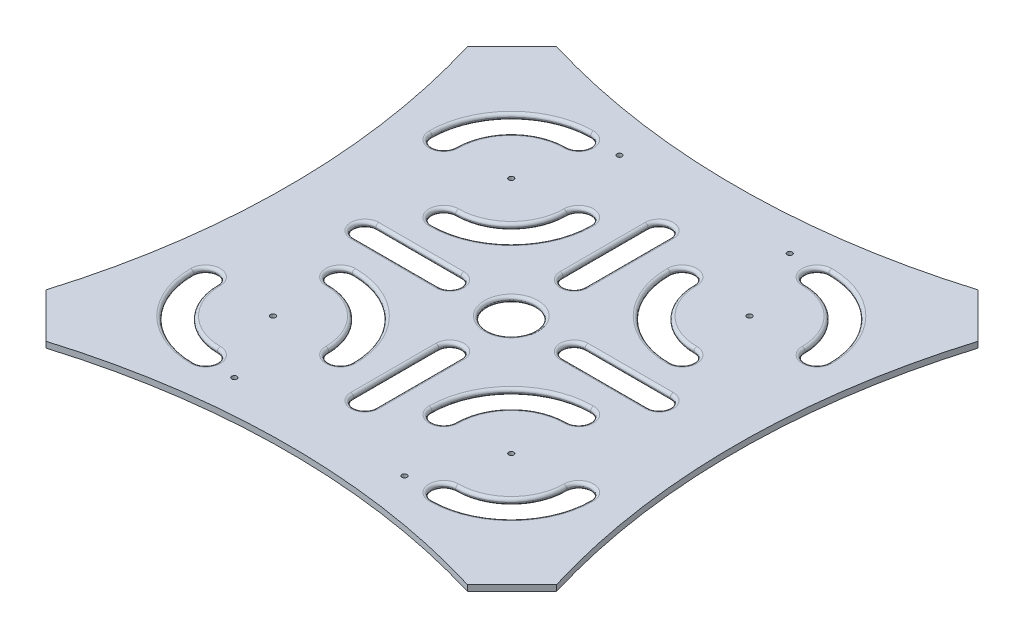
from build123d import *
from OCP.BRepAlgoAPI import BRepAlgoAPI_Cut
from OCP.TopTools import TopTools_ListOfShape

# Parameters (mm, degrees)
IZIM1_W                     = 300
IZIM1_H                     = 3.5
Y_KSEKLIK_EKSTR_ZYON1_DEPTH = 300
KES_EKSTR_ZYON5_DEPTH       = 10
IZIM10_R                    = 14
IZIM10_R_2                  = 1.5
KES_EKSTR_ZYON6_DEPTH       = 10
KES_EKSTR_ZYON8_DEPTH       = 10
KES_EKSTR_ZYON9_DEPTH       = 10
KES_EKSTR_ZYON10_DEPTH      = 10
RADYUS1_R                   = 1.75
RADYUS2_R                   = 1.75
L_EK1_SCALE                 = 0.5
IZIM17_R                    = 0.75
KES_EKSTR_ZYON12_DEPTH      = 10


with BuildPart() as part:
    # Çizim1 → Yükseklik-Ekstrüzyon1 (new body)
    with BuildSketch(Plane.XY):
        with Locations((150, 1.75)):
            Rectangle(IZIM1_W, IZIM1_H)
    extrude(amount=-Y_KSEKLIK_EKSTR_ZYON1_DEPTH)

    # Çizim8 → Kes-Ekstrüzyon5 (cut)
    with BuildSketch(Plane(origin=(0, 3.5, 0), x_dir=(1, 0, 0), z_dir=(0, 1, 0))):
        with BuildLine():
            Line((186.501870643, 156.494268219), (236.501870643, 156.494268219))
            ThreePointArc((236.501870643, 156.494268219), (242.996138862, 150), (236.501870643, 143.505731781))
            Line((236.501870643, 143.505731781), (186.501870643, 143.505731781))
            ThreePointArc((186.501870643, 143.505731781), (180.007602424, 150), (186.501870643, 156.494268219))
        make_face()
        with BuildLine():
            Line((143.505731781, 186.501870643), (143.505731781, 236.501870643))
            ThreePointArc((143.505731781, 236.501870643), (150, 242.996138862), (156.494268219, 236.501870643))
            Line((156.494268219, 236.501870643), (156.494268219, 186.501870643))
            ThreePointArc((156.494268219, 186.501870643), (150, 180.007602424), (143.505731781, 186.501870643))
        make_face()
        with BuildLine():
            Line((156.494268219, 113.498129357), (156.494268219, 63.498129357))
            ThreePointArc((156.494268219, 63.498129357), (150, 57.003861138), (143.505731781, 63.498129357))
            Line((143.505731781, 63.498129357), (143.505731781, 113.498129357))
            ThreePointArc((143.505731781, 113.498129357), (150, 119.992397576), (156.494268219, 113.498129357))
        make_face()
        with BuildLine():
            Line((113.498129357, 143.505731781), (63.498129357, 143.505731781))
            ThreePointArc((63.498129357, 143.505731781), (57.003861138, 150), (63.498129357, 156.494268219))
            Line((63.498129357, 156.494268219), (113.498129357, 156.494268219))
            ThreePointArc((113.498129357, 156.494268219), (119.992397576, 150), (113.498129357, 143.505731781))
        make_face()
    extrude(amount=-KES_EKSTR_ZYON5_DEPTH, mode=Mode.SUBTRACT)

    # Çizim10 → Kes-Ekstrüzyon6 (cut)
    with BuildSketch(Plane(origin=(0, 3.5, 0), x_dir=(1, 0, 0), z_dir=(0, 1, 0))):
        with Locations(Location((150, 149.58282898, 0), (0, 0, 270))):
            Circle(IZIM10_R)
        with Locations(Location((80, 219.58282898, 0), (0, 0, 270))):
            Circle(IZIM10_R_2)
        with Locations(Location((220, 219.58282898, 0), (0, 0, 270))):
            Circle(IZIM10_R_2)
        with Locations(Location((220, 79.58282898, 0), (0, 0, 90))):
            Circle(IZIM10_R_2)
        with Locations(Location((80, 79.58282898, 0), (0, 0, 90))):
            Circle(IZIM10_R_2)
    extrude(amount=-KES_EKSTR_ZYON6_DEPTH, mode=Mode.SUBTRACT)

    # Çizim13 → Kes-Ekstrüzyon8 (cut)
    with BuildSketch(Plane(origin=(0, 3.5, 0), x_dir=(1, 0, 0), z_dir=(0, 1, 0))):
        with BuildLine():
            ThreePointArc((80, 172.99784985), (112.940554645, 186.642274336), (126.58497913, 219.58282898))
            ThreePointArc((126.58497913, 219.58282898), (119.654189369, 226.513618742), (112.723399607, 219.58282898))
            ThreePointArc((112.723399607, 219.58282898), (103.138937765, 196.443891215), (80, 186.859429373))
            ThreePointArc((80, 186.859429373), (73.069210238, 179.928639612), (80, 172.99784985))
        make_face()
        with BuildLine():
            ThreePointArc((33.41502087, 219.58282898), (47.059445355, 252.523383625), (80, 266.16780811))
            ThreePointArc((80, 266.16780811), (86.930789762, 259.237018349), (80, 252.306228587))
            ThreePointArc((80, 252.306228587), (56.861062235, 242.721766745), (47.276600393, 219.58282898))
            ThreePointArc((47.276600393, 219.58282898), (40.345810631, 212.652039218), (33.41502087, 219.58282898))
        make_face()
        with BuildLine():
            ThreePointArc((220, 172.99784985), (187.059445355, 186.642274336), (173.41502087, 219.58282898))
            ThreePointArc((173.41502087, 219.58282898), (180.345810631, 226.513618742), (187.276600393, 219.58282898))
            ThreePointArc((187.276600393, 219.58282898), (196.861062235, 196.443891215), (220, 186.859429373))
            ThreePointArc((220, 186.859429373), (226.930789762, 179.928639612), (220, 172.99784985))
        make_face()
        with BuildLine():
            ThreePointArc((266.58497913, 219.58282898), (252.940554645, 252.523383625), (220, 266.16780811))
            ThreePointArc((220, 266.16780811), (213.069210238, 259.237018349), (220, 252.306228587))
            ThreePointArc((220, 252.306228587), (243.138937765, 242.721766745), (252.723399607, 219.58282898))
            ThreePointArc((252.723399607, 219.58282898), (259.654189369, 212.652039218), (266.58497913, 219.58282898))
        make_face()
        with BuildLine():
            ThreePointArc((33.41502087, 79.58282898), (47.059445355, 46.642274336), (80, 32.99784985))
            ThreePointArc((80, 32.99784985), (86.930789762, 39.928639612), (80, 46.859429373))
            ThreePointArc((80, 46.859429373), (56.861062235, 56.443891215), (47.276600393, 79.58282898))
            ThreePointArc((47.276600393, 79.58282898), (40.345810631, 86.513618742), (33.41502087, 79.58282898))
        make_face()
        with BuildLine():
            ThreePointArc((80, 126.16780811), (112.940554645, 112.523383625), (126.58497913, 79.58282898))
            ThreePointArc((126.58497913, 79.58282898), (119.654189369, 72.652039218), (112.723399607, 79.58282898))
            ThreePointArc((112.723399607, 79.58282898), (103.138937765, 102.721766745), (80, 112.306228587))
            ThreePointArc((80, 112.306228587), (73.069210238, 119.237018349), (80, 126.16780811))
        make_face()
        with BuildLine():
            ThreePointArc((220, 126.16780811), (187.059445355, 112.523383625), (173.41502087, 79.58282898))
            ThreePointArc((173.41502087, 79.58282898), (180.345810631, 72.652039218), (187.276600393, 79.58282898))
            ThreePointArc((187.276600393, 79.58282898), (196.861062235, 102.721766745), (220, 112.306228587))
            ThreePointArc((220, 112.306228587), (226.930789762, 119.237018349), (220, 126.16780811))
        make_face()
        with BuildLine():
            ThreePointArc((266.58497913, 79.58282898), (252.940554645, 46.642274336), (220, 32.99784985))
            ThreePointArc((220, 32.99784985), (213.069210238, 39.928639612), (220, 46.859429373))
            ThreePointArc((220, 46.859429373), (243.138937765, 56.443891215), (252.723399607, 79.58282898))
            ThreePointArc((252.723399607, 79.58282898), (259.654189369, 86.513618742), (266.58497913, 79.58282898))
        make_face()
    extrude(amount=-KES_EKSTR_ZYON8_DEPTH, mode=Mode.SUBTRACT)

    # Çizim2 → Kes-Ekstrüzyon9 (cut)
    with BuildSketch(Plane(origin=(0, 3.5, 0), x_dir=(1, 0, 0), z_dir=(0, 1, 0))):
        Polygon((0, 273.837049096), (26.162950904, 300), (0, 300), align=None)
        Polygon((273.837049096, 0), (300, 26.162950904), (300, 0), align=None)
        Polygon((273.837049096, 300), (300, 273.837049096), (300, 300), align=None)
        Polygon((0, 26.162950904), (26.162950904, 0), (0, 0), align=None)
    extrude(amount=-KES_EKSTR_ZYON9_DEPTH, mode=Mode.SUBTRACT)

    # Çizim16 → Kes-Ekstrüzyon10 (cut)
    with BuildSketch(Plane(origin=(0, 3.5, 0), x_dir=(1, 0, 0), z_dir=(0, 1, 0))):
        with BuildLine():
            Line((26.162950904, 0), (273.837049096, 0))
            ThreePointArc((273.837049096, 0), (150, 18.385809566), (26.162950904, 0))
        make_face()
        with BuildLine():
            Line((300, 26.162950904), (300, 273.837049096))
            ThreePointArc((300, 273.837049096), (281.614190434, 150), (300, 26.162950904))
        make_face()
        with BuildLine():
            Line((273.837049096, 300), (26.162950904, 300))
            ThreePointArc((26.162950904, 300), (150, 281.614190434), (273.837049096, 300))
        make_face()
        with BuildLine():
            Line((0, 273.837049096), (0, 26.162950904))
            ThreePointArc((0, 26.162950904), (18.385809566, 150), (0, 273.837049096))
        make_face()
    extrude(amount=-KES_EKSTR_ZYON10_DEPTH, mode=Mode.SUBTRACT)

    # Radyus1
    radyus1_edges = [part.edges().sort_by_distance(p)[0] for p in [
        (150, 3.5, -163.58282898),
        (40.345810631, 3.5, -86.513618742),
        (47.059445355, 3.5, -46.642274336),
        (86.930789762, 3.5, -39.928639612),
        (56.861062235, 3.5, -56.443891215),
        (259.654189369, 3.5, -212.652039218),
        (252.940554645, 3.5, -252.523383625),
        (213.069210238, 3.5, -259.237018349),
        (243.138937765, 3.5, -242.721766745),
        (226.930789762, 3.5, -179.928639612),
        (196.861062235, 3.5, -196.443891215),
        (180.345810631, 3.5, -226.513618742),
        (187.059445355, 3.5, -186.642274336),
        (40.345810631, 3.5, -212.652039218),
        (56.861062235, 3.5, -242.721766745),
        (86.930789762, 3.5, -259.237018349),
        (47.059445355, 3.5, -252.523383625),
        (259.654189369, 3.5, -86.513618742),
        (243.138937765, 3.5, -56.443891215),
        (213.069210238, 3.5, -39.928639612),
        (252.940554645, 3.5, -46.642274336),
        (226.930789762, 3.5, -119.237018349),
        (187.059445355, 3.5, -112.523383625),
        (180.345810631, 3.5, -72.652039218),
        (196.861062235, 3.5, -102.721766745),
        (73.069210238, 3.5, -119.237018349),
        (103.138937765, 3.5, -102.721766745),
        (119.654189369, 3.5, -72.652039218),
        (112.940554645, 3.5, -112.523383625),
        (73.069210238, 3.5, -179.928639612),
        (112.940554645, 3.5, -186.642274336),
        (119.654189369, 3.5, -226.513618742),
        (103.138937765, 3.5, -196.443891215),
        (180.007602424, 3.5, -150),
        (211.501870643, 3.5, -143.505731781),
        (242.996138862, 3.5, -150),
        (211.501870643, 3.5, -156.494268219),
        (150, 3.5, -180.007602424),
        (156.494268219, 3.5, -211.501870643),
        (150, 3.5, -242.996138862),
        (143.505731781, 3.5, -211.501870643),
        (150, 3.5, -119.992397576),
        (143.505731781, 3.5, -88.498129357),
        (150, 3.5, -57.003861138),
        (156.494268219, 3.5, -88.498129357),
        (119.992397576, 3.5, -150),
        (88.498129357, 3.5, -156.494268219),
        (57.003861138, 3.5, -150),
        (88.498129357, 3.5, -143.505731781),
    ]]
    fillet(radyus1_edges, radius=RADYUS1_R)

    # Radyus2
    radyus2_edges = [part.edges().sort_by_distance(p)[0] for p in [
        (156.494268219, 0, -211.501870643),
        (150, 0, -242.996138862),
        (143.505731781, 0, -211.501870643),
        (259.654189369, 0, -212.652039218),
        (252.940554645, 0, -252.523383625),
        (213.069210238, 0, -259.237018349),
        (86.930789762, 0, -259.237018349),
        (47.059445355, 0, -252.523383625),
        (40.345810631, 0, -212.652039218),
        (119.654189369, 0, -226.513618742),
        (103.138937765, 0, -196.443891215),
        (73.069210238, 0, -179.928639612),
        (119.992397576, 0, -150),
        (88.498129357, 0, -156.494268219),
        (57.003861138, 0, -150),
        (242.996138862, 0, -150),
        (211.501870643, 0, -156.494268219),
        (180.007602424, 0, -150),
        (226.930789762, 0, -179.928639612),
        (196.861062235, 0, -196.443891215),
        (180.345810631, 0, -226.513618742),
        (259.654189369, 0, -86.513618742),
        (243.138937765, 0, -56.443891215),
        (213.069210238, 0, -39.928639612),
        (196.861062235, 0, -102.721766745),
        (226.930789762, 0, -119.237018349),
        (187.059445355, 0, -112.523383625),
        (156.494268219, 0, -88.498129357),
        (150, 0, -119.992397576),
        (143.505731781, 0, -88.498129357),
        (112.940554645, 0, -112.523383625),
        (73.069210238, 0, -119.237018349),
        (103.138937765, 0, -102.721766745),
        (86.930789762, 0, -39.928639612),
        (56.861062235, 0, -56.443891215),
        (40.345810631, 0, -86.513618742),
        (150, 0, -180.007602424),
        (243.138937765, 0, -242.721766745),
        (56.861062235, 0, -242.721766745),
        (112.940554645, 0, -186.642274336),
        (88.498129357, 0, -143.505731781),
        (150, 0, -163.58282898),
        (211.501870643, 0, -143.505731781),
        (187.059445355, 0, -186.642274336),
        (252.940554645, 0, -46.642274336),
        (180.345810631, 0, -72.652039218),
        (150, 0, -57.003861138),
        (119.654189369, 0, -72.652039218),
        (47.059445355, 0, -46.642274336),
    ]]
    fillet(radyus2_edges, radius=RADYUS2_R - 0.0001)  # a hair under: the kernel refuses the full size


with BuildPart() as part_1:
    # Ölçek1: scaled about (150, 1.749999195, -150.06085627)
    add(part.part.scale(L_EK1_SCALE).moved(Location((75, 0.874999598, -75.030428135))))


with BuildPart() as kes_ekstr_zyon12_tool:
    # Çizim17 → Kes-Ekstrüzyon12 (new body)
    with BuildSketch(Plane(origin=(0, 0.875, 0), x_dir=(-1, 0, 0), z_dir=(0, -1, 0))):
        with Locations(Location((-125, 93.440345935, 0), (0, 0, 90))):
            Circle(IZIM17_R)
        with Locations(Location((-175, 93.440345935, 0), (0, 0, 90))):
            Circle(IZIM17_R)
        with Locations(Location((-125, 206.620510583, 0), (0, 0, 90))):
            Circle(IZIM17_R)
        with Locations(Location((-175, 206.620510583, 0), (0, 0, 90))):
            Circle(IZIM17_R)
    extrude(amount=-KES_EKSTR_ZYON12_DEPTH)


with BuildPart() as part_2:
    add(part_1.part)

    # Kes-Ekstrüzyon12: cut by kes_ekstr_zyon12_tool, with a tolerance
    kes_ekstr_zyon12_stock = TopTools_ListOfShape()
    kes_ekstr_zyon12_stock.Append(part_2.part.wrapped)
    kes_ekstr_zyon12_tools = TopTools_ListOfShape()
    kes_ekstr_zyon12_tools.Append(kes_ekstr_zyon12_tool.part.wrapped)
    kes_ekstr_zyon12_cut = BRepAlgoAPI_Cut()
    kes_ekstr_zyon12_cut.SetArguments(kes_ekstr_zyon12_stock)
    kes_ekstr_zyon12_cut.SetTools(kes_ekstr_zyon12_tools)
    kes_ekstr_zyon12_cut.SetFuzzyValue(0.00001)
    kes_ekstr_zyon12_cut.Build()
    add(Compound.cast(kes_ekstr_zyon12_cut.Shape()).solids(), mode=Mode.REPLACE)


solid = part_2.part
